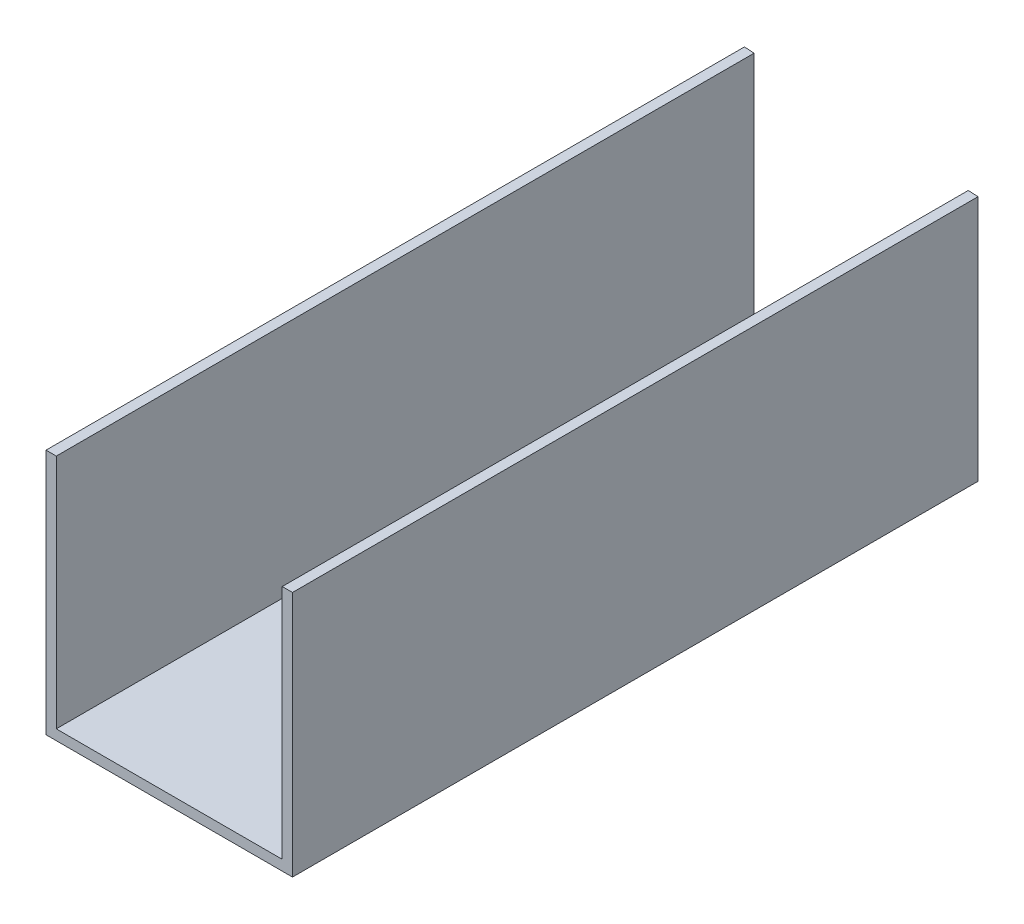
from build123d import *

# Parameters (mm, degrees)
BOSS_EXTRUDE1_DEPTH = 107.95
CUT_EXTRUDE1_DEPTH  = 98.425


with BuildPart() as part:
    # Sketch1 → Boss-Extrude1 (new body)
    with BuildSketch(Plane.XY):
        Polygon((18.371241491, 0), (-19.728758509, 0), (-19.728758509, 38.1), (-18.141258509, 38.1), (-18.141258509, 1.5875), (16.783741491, 1.5875), (16.783741491, 38.1), (18.371241491, 38.1), align=None)
    extrude(amount=BOSS_EXTRUDE1_DEPTH)

    # Sketch2 → Cut-Extrude1 (cut)
    with BuildSketch(Plane(origin=(0, 38.1, 0), x_dir=(1, 0, 0), z_dir=(0, 1, 0))):
        Polygon((-19.728758509, 0), (18.371241491, 0), (18.371241491, -1.996736391), align=None)
    extrude(amount=-CUT_EXTRUDE1_DEPTH, mode=Mode.SUBTRACT)


solid = part.part
